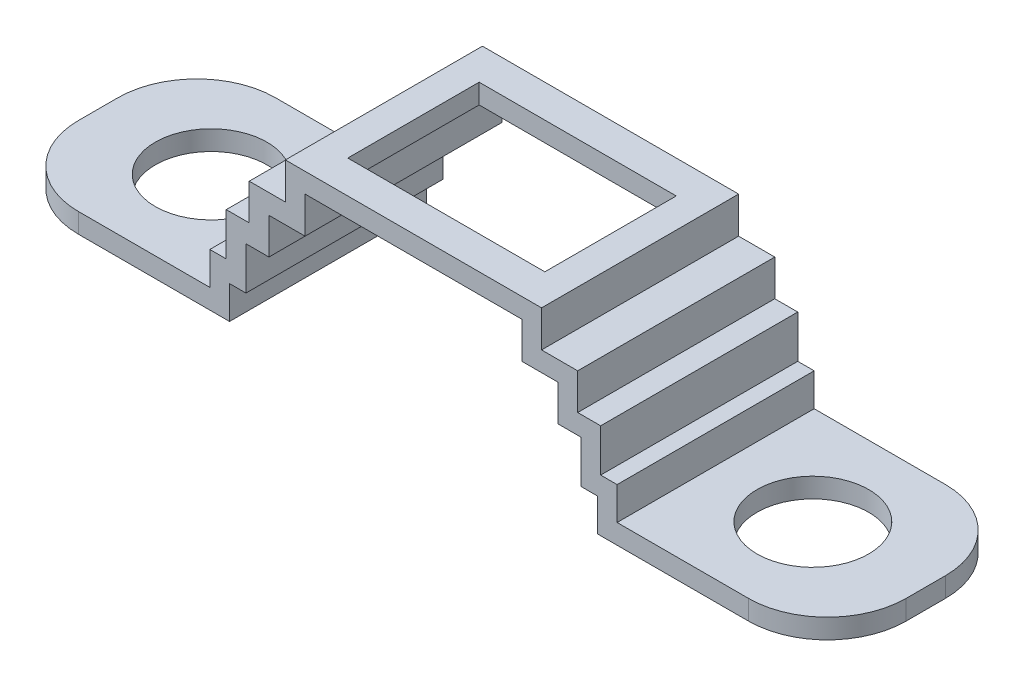
from build123d import *

# Parameters (mm, degrees)
EXTRUDE_THIN1_DEPTH  = 15
SKETCH2_R            = 8.5
CUT_EXTRUDE1_DEPTH   = 69.574794932
FILLET1_R            = 12
FILLET1_OF_MIRROR1_R = 12
SKETCH3_W            = 30
SKETCH3_H            = 20
CUT_EXTRUDE2_DEPTH   = 70.618980889


with BuildPart() as part:
    # Sketch1 → Extrude-Thin1 (new, symmetric)
    with BuildSketch(Plane.XY):
        Polygon((-63, 4.5), (-28, 4.5), (-28, 9.5), (-25.5, 9.5), (-25.5, 16), (-22, 16), (-22, 21.5), (-16.5, 21.5), (-16.5, 27.05), (0, 27.05), (0, 30.05), (-19.5, 30.05), (-19.5, 24.5), (-25, 24.5), (-25, 19), (-28.5, 19), (-28.5, 12.5), (-31, 12.5), (-31, 7.5), (-63, 7.5), align=None)
    extrude_thin1 = extrude(amount=EXTRUDE_THIN1_DEPTH, both=True)

    # Sketch2 → Cut-Extrude1 (cut, through all)
    with BuildSketch(Plane(origin=(0, 7.5, 0), x_dir=(1, 0, 0), z_dir=(0, 1, 0))):
        with Locations((-45.8, 0)):
            Circle(SKETCH2_R)
    cut_extrude1 = extrude(amount=-CUT_EXTRUDE1_DEPTH, mode=Mode.SUBTRACT)

    # Fillet1
    fillet1_edges = [part.edges().sort_by_distance(p)[0] for p in [
        (-63, 6, -15),
        (-63, 6, 15),
    ]]
    fillet(fillet1_edges, radius=FILLET1_R)

    # Mirror1: Extrude-Thin1, Cut-Extrude1 across plane
    add(extrude_thin1.mirror(Plane(origin=(0, 30.05, 15), x_dir=(0, 0, 1), z_dir=(1, 0, 0))))
    add(cut_extrude1.mirror(Plane(origin=(0, 30.05, 15), x_dir=(0, 0, 1), z_dir=(1, 0, 0))), mode=Mode.SUBTRACT)

    # Fillet1 of Mirror1
    fillet1_of_mirror1_edges = [part.edges().sort_by_distance(p)[0] for p in [
        (63, 6, -15),
        (63, 6, 15),
    ]]
    fillet(fillet1_of_mirror1_edges, radius=FILLET1_OF_MIRROR1_R)

    # Sketch3 → Cut-Extrude2 (cut, through all)
    with BuildSketch(Plane(origin=(0, 30.05, 0), x_dir=(1, 0, 0), z_dir=(0, 1, 0))):
        Rectangle(SKETCH3_W, SKETCH3_H)
    extrude(amount=-CUT_EXTRUDE2_DEPTH, mode=Mode.SUBTRACT)


solid = part.part
